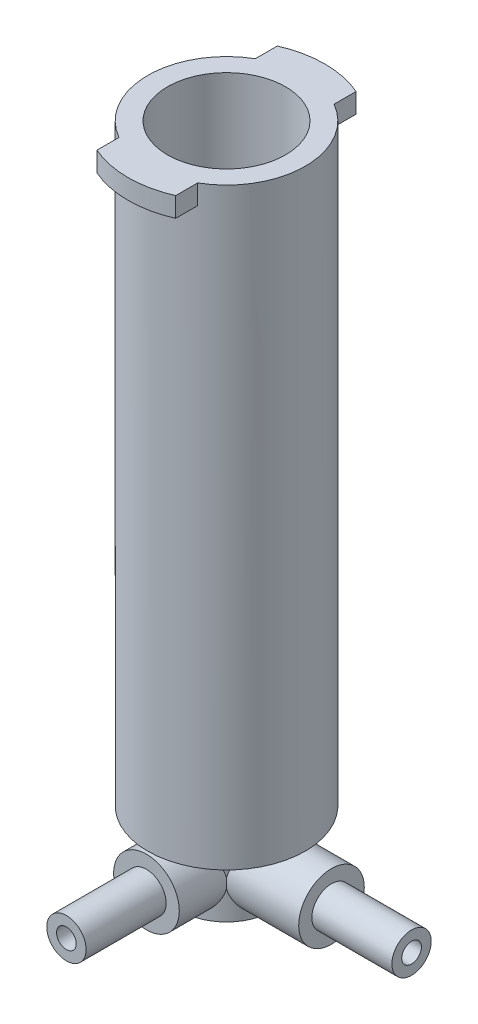
from build123d import *

# Parameters (mm, degrees)
SKETCH1_R           = 6
BOSS_EXTRUDE1_DEPTH = 45.2
SHELL1_T            = -1.5
SKETCH2_R           = 3.5
BOSS_EXTRUDE2_DEPTH = 5.2
SHELL2_START        = -3.7
SHELL2_OUTLINE_R    = 2
SHELL2_DEPTH        = 5.2
SKETCH3_R           = 2.5
BOSS_EXTRUDE3_DEPTH = 6.1
SKETCH4_R           = 1.5
BOSS_EXTRUDE4_DEPTH = 6.1
SKETCH5_R           = 0.75
CUT_EXTRUDE1_DEPTH  = 12.1
SKETCH6_R           = 2
CUT_EXTRUDE2_DEPTH  = 12.1
SKETCH7_R           = 2.5
BOSS_EXTRUDE5_DEPTH = 8
SKETCH8_R           = 1.5
BOSS_EXTRUDE6_DEPTH = 6.1
SKETCH9_R           = 0.75
CUT_EXTRUDE3_DEPTH  = 14.1
SKETCH10_R          = 2
CUT_EXTRUDE4_DEPTH  = 14.1
BOSS_EXTRUDE7_START = -1.5
BOSS_EXTRUDE7_DEPTH = 1.5


# Read off the part's stored shape, not the designer's step: Shell2
with BuildPart() as part:
    # Sketch1 → Boss-Extrude1 (new body)
    with BuildSketch(Plane(origin=(0, 0, 0), x_dir=(1, 0, 0), z_dir=(0, 1, 0))):
        with Locations(Location((0, 0, 0), (0, 0, 270))):
            Circle(SKETCH1_R)
    extrude(amount=BOSS_EXTRUDE1_DEPTH)

    # Shell1
    shell1_openings = [part.faces().sort_by_distance(p)[0] for p in [
        (0, 45.2, 0),
    ]]
    offset(amount=SHELL1_T, openings=shell1_openings, kind=Kind.INTERSECTION)

    # Sketch2 → Boss-Extrude2 (add)
    with BuildSketch(Plane.XZ):
        with Locations(Location((0, 0, 0), (0, 0, 270))):
            Circle(SKETCH2_R)
    extrude(amount=BOSS_EXTRUDE2_DEPTH)

    # Shell2 outline → Shell2 (cut)
    with BuildSketch(Plane(origin=(0, 0, 0), x_dir=(1, 0, 0), z_dir=(0, 1, 0)).offset(SHELL2_START)):
        Circle(SHELL2_OUTLINE_R)
    extrude(amount=SHELL2_DEPTH, mode=Mode.SUBTRACT)

    # Sketch3 → Boss-Extrude3 (add)
    with BuildSketch(Plane.XY):
        with Locations(Location((0, -2.644163182, 0), (0, 0, 270))):
            Circle(SKETCH3_R)
    extrude(amount=BOSS_EXTRUDE3_DEPTH)

    # Sketch4 → Boss-Extrude4 (add)
    with BuildSketch(Plane.XY.offset(6.1)):
        with Locations((0, -2.644163182)):
            Circle(SKETCH4_R)
    extrude(amount=BOSS_EXTRUDE4_DEPTH)

    # Sketch5 → Cut-Extrude1 (cut)
    with BuildSketch(Plane.XY.offset(12.2)):
        with Locations((0, -2.644163182)):
            Circle(SKETCH5_R)
    extrude(amount=-CUT_EXTRUDE1_DEPTH, mode=Mode.SUBTRACT)

    # Sketch6 → Cut-Extrude2 (cut)
    with BuildSketch(Plane(origin=(0, -3.7, 0), x_dir=(1, 0, 0), z_dir=(0, 1, 0))):
        with Locations(Location((0, 0, 0), (0, 0, 270))):
            Circle(SKETCH6_R)
    extrude(amount=CUT_EXTRUDE2_DEPTH, mode=Mode.SUBTRACT)

    # Sketch7 → Boss-Extrude5 (add)
    with BuildSketch(Plane(origin=(0, 0, 0), x_dir=(0, 0, -1), z_dir=(1, 0, 0))):
        with Locations(Location((0, -2.644163182, 0), (0, 0, 188.130102354))):
            Circle(SKETCH7_R)
    extrude(amount=BOSS_EXTRUDE5_DEPTH)

    # Sketch8 → Boss-Extrude6 (add)
    with BuildSketch(Plane(origin=(8, 0, 0), x_dir=(0, 0, -1), z_dir=(1, 0, 0))):
        with Locations((0, -2.644163182)):
            Circle(SKETCH8_R)
    extrude(amount=BOSS_EXTRUDE6_DEPTH)

    # Sketch9 → Cut-Extrude3 (cut)
    with BuildSketch(Plane(origin=(14.1, 0, 0), x_dir=(0, 0, -1), z_dir=(1, 0, 0))):
        with Locations((0, -2.644163182)):
            Circle(SKETCH9_R)
    extrude(amount=-CUT_EXTRUDE3_DEPTH, mode=Mode.SUBTRACT)

    # Sketch10 → Cut-Extrude4 (cut)
    with BuildSketch(Plane(origin=(0, -3.7, 0), x_dir=(1, 0, 0), z_dir=(0, 1, 0))):
        with Locations(Location((0, 0, 0), (0, 0, 270))):
            Circle(SKETCH10_R)
    extrude(amount=CUT_EXTRUDE4_DEPTH, mode=Mode.SUBTRACT)

    # Sketch11 → Boss-Extrude7 (add)
    with BuildSketch(Plane(origin=(0, 45.2, 0), x_dir=(1, 0, 0), z_dir=(0, 1, 0)).offset(BOSS_EXTRUDE7_START)):
        with BuildLine():
            Line((3, -5.196152423), (3, -6.873863542))
            ThreePointArc((3, -6.873863542), (0, -7.5), (-3, -6.873863542))
            Line((-3, -6.873863542), (-3, -5.196152423))
            ThreePointArc((-3, -5.196152423), (0, -6), (3, -5.196152423))
        make_face()
        with BuildLine():
            Line((-3, 5.196152423), (-3, 6.873863542))
            ThreePointArc((-3, 6.873863542), (0, 7.5), (3, 6.873863542))
            Line((3, 6.873863542), (3, 5.196152423))
            ThreePointArc((3, 5.196152423), (0, 6), (-3, 5.196152423))
        make_face()
    extrude(amount=BOSS_EXTRUDE7_DEPTH)


solid = part.part
